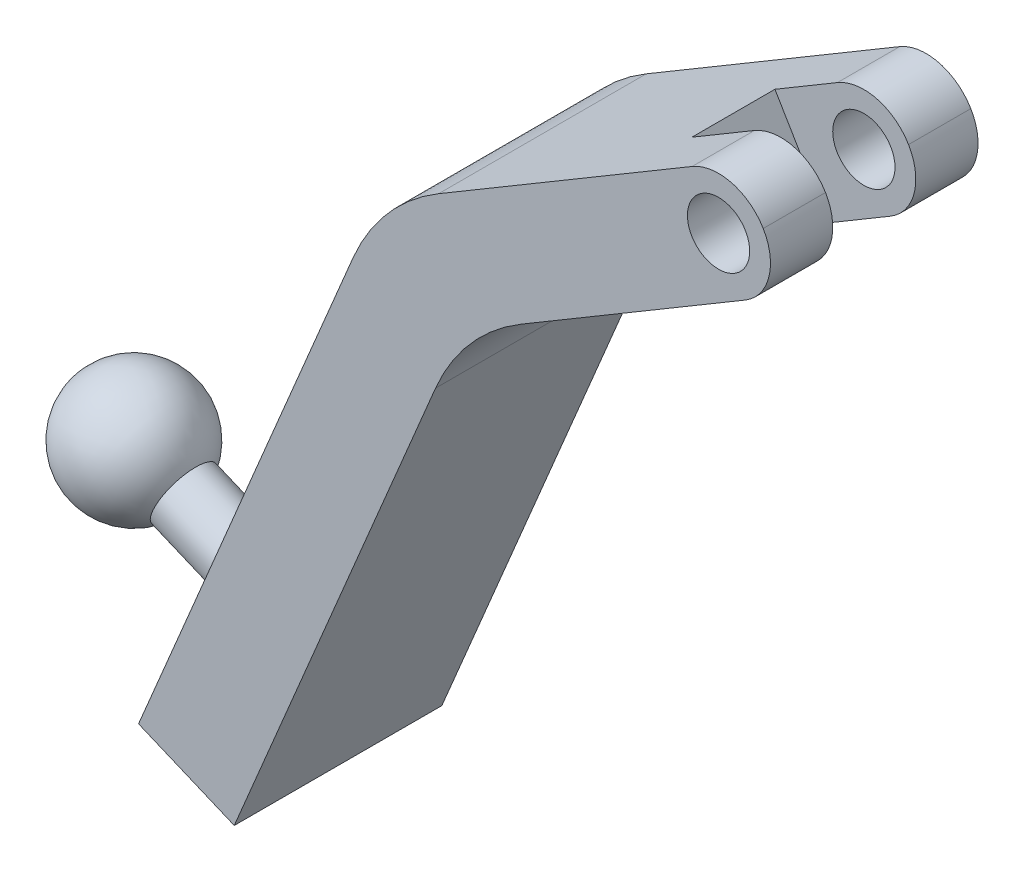
from build123d import *

# Parameters (mm, degrees)
BOSS_EXTRU_1_DEPTH      = 10
BOSS_EXTRU_1_DEPTH_BACK = 10
ESQUISSE2_W             = 16.778324123
ESQUISSE2_H             = 8
ENL_V_MAT_EXTRU_2_DEPTH = 77.675205123
ESQUISSE3_R             = 3
ENL_V_MAT_EXTRU_3_DEPTH = 74.486360502
ESQUISSE4_R             = 3
BOSS_EXTRU_2_DEPTH      = 10
CONG_2_R                = 5


with BuildPart() as part:
    # Esquisse1 → Boss.-Extru.1 (new, two sides: drawn at the far end of the back side and taken through both)
    with BuildSketch(Plane.XY.offset(-BOSS_EXTRU_1_DEPTH_BACK)):
        with BuildLine():
            Line((42.458304448, 52.329533504), (13.73470128, 35.295768835))
            ThreePointArc((13.73470128, 35.295768835), (8.854424282, 31.228601734), (5.495862123, 25.836105835))
            Line((5.495862123, 25.836105835), (-15.175609455, -23.394635688))
            Line((-15.175609455, -23.394635688), (-5.955424705, -27.266094479))
            Line((-5.955424705, -27.266094479), (13.437406292, 18.919463554))
            ThreePointArc((13.437406292, 18.919463554), (16.795968451, 24.311959453), (21.676245449, 28.379126554))
            Line((21.676245449, 28.379126554), (47.55906962, 43.728243213))
            Line((47.55906962, 43.728243213), (42.458304448, 52.329533504))
        make_face()
    extrude(amount=BOSS_EXTRU_1_DEPTH + BOSS_EXTRU_1_DEPTH_BACK)

    # Esquisse2 → Enlèv. mat.-Extru.2 (cut, through all)
    with BuildSketch(Plane(origin=(-11.911901978, 20.08673667, 0), x_dir=(0.8601290290322577, 0.5100765172168049, 0), z_dir=(-0.5100765172168049, 0.8601290290322577, 0))):
        with Locations((59.600848438, 0)):
            Rectangle(ESQUISSE2_W, ESQUISSE2_H)
    extrude(amount=-ENL_V_MAT_EXTRU_2_DEPTH, mode=Mode.SUBTRACT)

    # Esquisse3 → Enlèv. mat.-Extru.3 (cut, through all)
    with BuildSketch(Plane.XY.offset(10)):
        with Locations((40.705018812, 45.476713018)):
            Circle(ESQUISSE3_R)
    extrude(amount=-ENL_V_MAT_EXTRU_3_DEPTH, mode=Mode.SUBTRACT)

    # Esquisse4 → Boss.-Extru.2 (add)
    with BuildSketch(Plane(origin=(-4.550212337, 1.910586396, 0), x_dir=(0, 0, 1), z_dir=(-0.9220184750588774, 0.38714587903024655, 0))):
        with Locations(Location((0, -19.124935546, 0), (0, 0, 270))):
            Circle(ESQUISSE4_R)
    extrude(amount=BOSS_EXTRU_2_DEPTH)

    # Esquisse5 → Révolution1 (revolve)
    with BuildSketch(Plane.XY):
        with BuildLine():
            Line((-20.095687486, -12.304496338), (-31.159909187, -7.658745789))
            ThreePointArc((-31.159909187, -7.658745789), (-23.304923062, -4.449510213), (-20.095687486, -12.304496338))
        make_face()
    revolve(axis=Axis((-21.174537071, -11.851498722, 0), (-0.9220184750588776, 0.3871458790302464, 0)))

    # Congé2
    cong_2_edges = [part.edges().sort_by_distance(p)[0] for p in [
        (47.55906962, 43.728243213, 7),
        (42.458304448, 52.329533504, 7),
        (42.458304448, 52.329533504, -7),
        (47.55906962, 43.728243213, -7),
    ]]
    fillet(cong_2_edges, radius=CONG_2_R - 0.0001)  # a hair under: the kernel refuses the full size


solid = part.part
